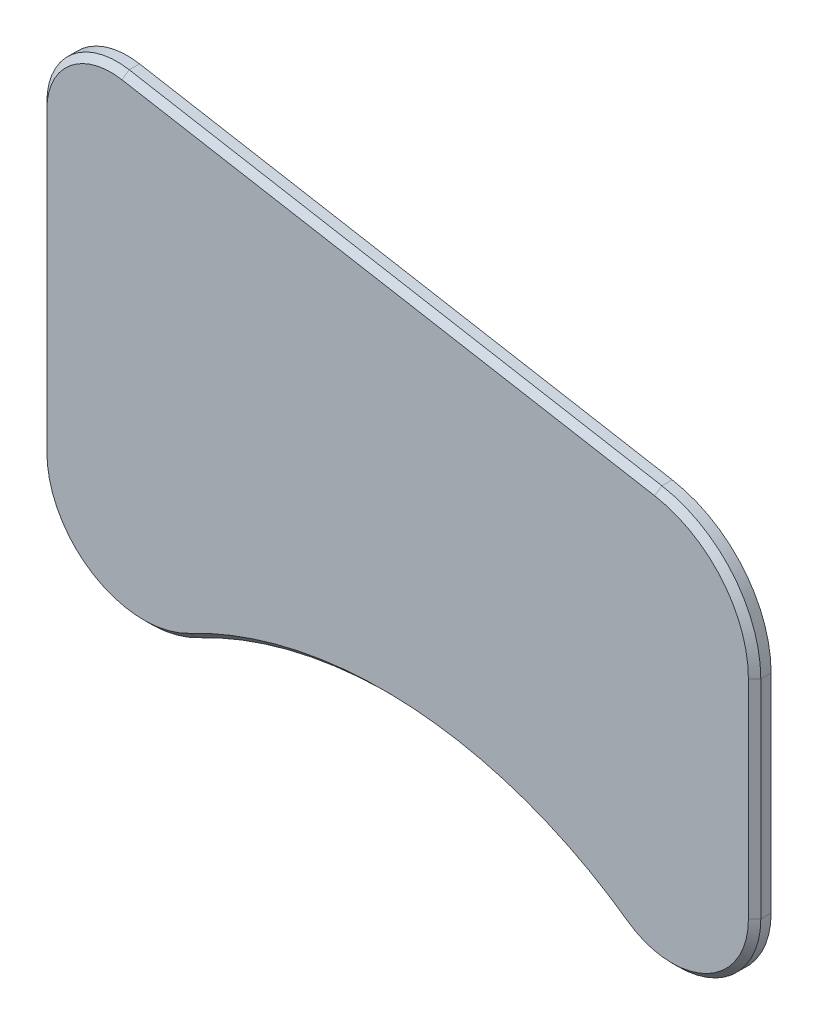
from build123d import *

# Parameters (mm, degrees)
BOSS_EXTRUDE1_DEPTH = 4
CHAMFER1_SIZE       = 1.5


with BuildPart() as part:
    # Sketch1 → Boss-Extrude1 (new body)
    with BuildSketch(Plane.XY):
        with BuildLine():
            Line((-70.04798098, 42.798720736), (59.035797152, 20.037767879))
            ThreePointArc((59.035797152, 20.037767879), (76.21528885, 10.119183723), (83, -8.521656958))
            Line((83, -8.521656958), (83, -58.921656958))
            ThreePointArc((83, -58.921656958), (72.147912935, -76.706923022), (51.368431106, -75.191463505))
            ThreePointArc((51.368431106, -75.191463505), (0.018293401, -56.7724897), (-53.357882673, -68.045424814))
            ThreePointArc((-53.357882673, -68.045424814), (-77.92182392, -67.32320986), (-90, -45.921656958))
            Line((-90, -45.921656958), (-90, 26.056988934))
            ThreePointArc((-90, 26.056988934), (-83.927389365, 39.079744467), (-70.04798098, 42.798720736))
        make_face()
    extrude(amount=BOSS_EXTRUDE1_DEPTH)

    # Chamfer1
    chamfer1_edges = [part.edges().sort_by_distance(p)[0] for p in [
        (72.147912935, -76.706923022, 4),
        (83, -33.721656958, 4),
        (0.018293401, -56.7724897, 4),
        (76.21528885, 10.119183723, 4),
        (-77.92182392, -67.32320986, 4),
        (-5.506091914, 31.418244307, 4),
        (-90, -9.932334012, 4),
        (-83.927389365, 39.079744467, 4),
    ]]
    chamfer(chamfer1_edges, length=CHAMFER1_SIZE)


solid = part.part
